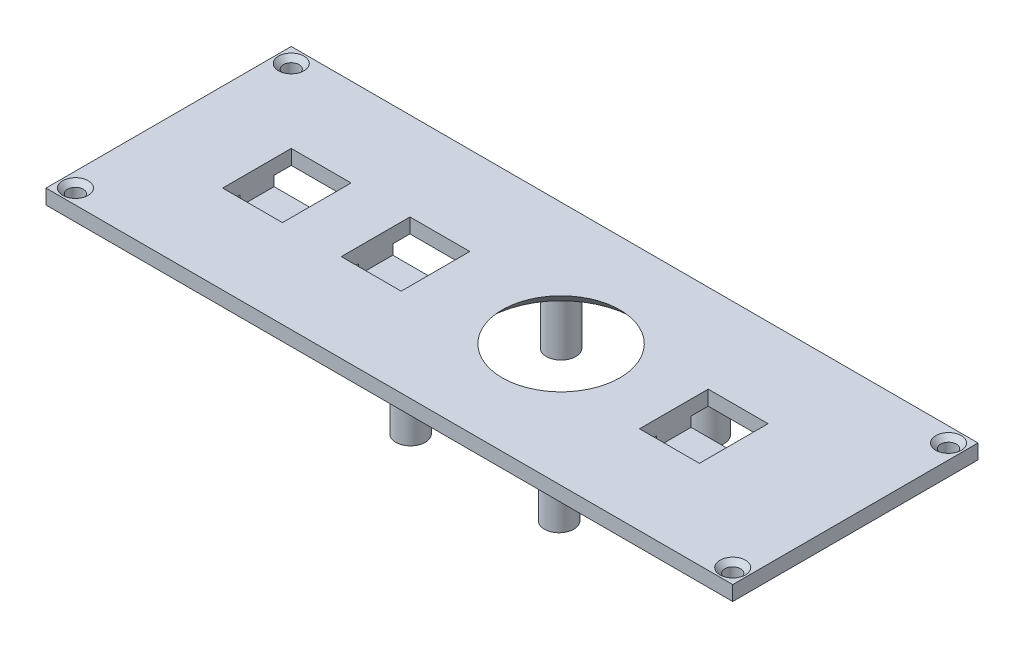
from build123d import *

# Parameters (mm, degrees)
SKETCH1_W           = 140
SKETCH1_H           = 50
BOSS_EXTRUDE1_DEPTH = 3
SKETCH2_R           = 1.6
CUT_EXTRUDE1_DEPTH  = 3
SKETCH3_R           = 12
CUT_EXTRUDE2_DEPTH  = 3
CHAMFER1_SIZE       = 1
CHAMFER2_SIZE       = 3
SKETCH4_R           = 3
SKETCH4_R_2         = 1.45
BOSS_EXTRUDE2_DEPTH = 13
FILLET1_R           = 2
SKETCH5_W           = 12.2
SKETCH5_H           = 14
CUT_EXTRUDE3_DEPTH  = 13
SKETCH6_W           = 3
SKETCH6_H           = 7
BOSS_EXTRUDE3_DEPTH = 2
SKETCH7_W           = 18.2
SKETCH7_H           = 7
BOSS_EXTRUDE4_DEPTH = 2


with BuildPart() as part:
    # Sketch1 → Boss-Extrude1 (new body)
    with BuildSketch(Plane(origin=(0, 0, 0), x_dir=(1, 0, 0), z_dir=(0, 1, 0))):
        with Locations((25.027932961, -7.332402235)):
            Rectangle(SKETCH1_W, SKETCH1_H)
    extrude(amount=BOSS_EXTRUDE1_DEPTH)

    # Sketch2 → Cut-Extrude1 (cut)
    with BuildSketch(Plane(origin=(0, 3, 0), x_dir=(1, 0, 0), z_dir=(0, 1, 0))):
        with Locations(Location((-41.972067039, 14.667597765, 0), (0, 0, 270))):
            Circle(SKETCH2_R)
        with Locations(Location((92.027932961, 14.667597765, 0), (0, 0, 270))):
            Circle(SKETCH2_R)
        with Locations(Location((-41.972067039, -29.332402235, 0), (0, 0, 270))):
            Circle(SKETCH2_R)
        with Locations(Location((92.027932961, -29.332402235, 0), (0, 0, 270))):
            Circle(SKETCH2_R)
    extrude(amount=-CUT_EXTRUDE1_DEPTH, mode=Mode.SUBTRACT)

    # Sketch3 → Cut-Extrude2 (cut)
    with BuildSketch(Plane(origin=(0, 3, 0), x_dir=(1, 0, 0), z_dir=(0, 1, 0))):
        with Locations(Location((35.027932961, -7.332402235, 0), (0, 0, 270))):
            Circle(SKETCH3_R)
    extrude(amount=-CUT_EXTRUDE2_DEPTH, mode=Mode.SUBTRACT)

    # Chamfer1
    chamfer1_edges = [part.edges().sort_by_distance(p)[0] for p in [
        (92.027932961, 3, -16.267597765),
        (-41.972067039, 3, 27.732402235),
        (92.027932961, 3, 27.732402235),
        (-41.972067039, 3, -16.267597765),
    ]]
    chamfer(chamfer1_edges, length=CHAMFER1_SIZE)

    # Chamfer2
    chamfer2_edges = [part.edges().sort_by_distance(p)[0] for p in [
        (35.027932961, 0, -4.667597765),
    ]]
    chamfer(chamfer2_edges, length=CHAMFER2_SIZE - 0.0001)  # a hair under: the kernel refuses the full size

    # Sketch4 → Boss-Extrude2 (add)
    # profile 1 of 4: a face of its own
    with BuildSketch(Plane.XZ):
        with Locations(Location((19.787932961, -7.907597765, 0), (0, 0, 90))):
            Circle(SKETCH4_R)
        with Locations(Location((19.787932961, -7.907597765, 0), (0, 0, 90))):
            Circle(SKETCH4_R_2, mode=Mode.SUBTRACT)
    # profile 2 of 4: a face of its own
    with BuildSketch(Plane.XZ):
        with Locations(Location((19.587932961, 22.572402235, 0), (0, 0, 90))):
            Circle(SKETCH4_R)
        with Locations(Location((19.587932961, 22.572402235, 0), (0, 0, 90))):
            Circle(SKETCH4_R_2, mode=Mode.SUBTRACT)
    # profile 3 of 4: a face of its own
    with BuildSketch(Plane.XZ):
        with Locations(Location((50.067932961, 22.772402235, 0), (0, 0, 90))):
            Circle(SKETCH4_R)
        with Locations(Location((50.067932961, 22.772402235, 0), (0, 0, 90))):
            Circle(SKETCH4_R_2, mode=Mode.SUBTRACT)
    # profile 4 of 4: a face of its own
    with BuildSketch(Plane.XZ):
        with Locations(Location((50.267932961, -7.707597765, 0), (0, 0, 90))):
            Circle(SKETCH4_R)
        with Locations(Location((50.267932961, -7.707597765, 0), (0, 0, 90))):
            Circle(SKETCH4_R_2, mode=Mode.SUBTRACT)
    extrude(amount=BOSS_EXTRUDE2_DEPTH)

    # Fillet1
    fillet1_edges = [part.edges().sort_by_distance(p)[0] for p in [
        (19.787932961, 0, -10.907597765),
        (19.587932961, 0, 19.572402235),
        (50.067932961, 0, 19.772402235),
        (50.267932961, 0, -10.707597765),
    ]]
    fillet(fillet1_edges, radius=FILLET1_R)

    # Sketch5 → Cut-Extrude3 (cut)
    with BuildSketch(Plane(origin=(0, 3, 0), x_dir=(1, 0, 0), z_dir=(0, 1, 0))):
        with Locations((-20.872067039, -7.332402235)):
            Rectangle(SKETCH5_W, SKETCH5_H)
        with Locations((3.327932961, -7.332402235)):
            Rectangle(SKETCH5_W, SKETCH5_H)
        with Locations((64.127932961, -7.332402235)):
            Rectangle(SKETCH5_W, SKETCH5_H)
    extrude(amount=-CUT_EXTRUDE3_DEPTH, mode=Mode.SUBTRACT)

    # Sketch6 → Boss-Extrude3 (add)
    with BuildSketch(Plane.XZ):
        with Locations((-28.472067039, 7.332402235)):
            Rectangle(SKETCH6_W, SKETCH6_H)
        with Locations((-13.272067039, 7.332402235)):
            Rectangle(SKETCH6_W, SKETCH6_H)
        with Locations((-4.272067039, 7.332402235)):
            Rectangle(SKETCH6_W, SKETCH6_H)
        with Locations((10.927932961, 7.332402235)):
            Rectangle(SKETCH6_W, SKETCH6_H)
        with Locations((56.527932961, 7.332402235)):
            Rectangle(SKETCH6_W, SKETCH6_H)
        with Locations((71.727932961, 7.332402235)):
            Rectangle(SKETCH6_W, SKETCH6_H)
    extrude(amount=BOSS_EXTRUDE3_DEPTH)

    # Sketch7 → Boss-Extrude4 (add)
    with BuildSketch(Plane.XZ.offset(2)):
        with Locations((-20.872067039, 7.332402235)):
            Rectangle(SKETCH7_W, SKETCH7_H)
        with Locations((3.327932961, 7.332402235)):
            Rectangle(SKETCH7_W, SKETCH7_H)
        with Locations((64.127932961, 7.332402235)):
            Rectangle(SKETCH7_W, SKETCH7_H)
    extrude(amount=BOSS_EXTRUDE4_DEPTH)


solid = part.part
